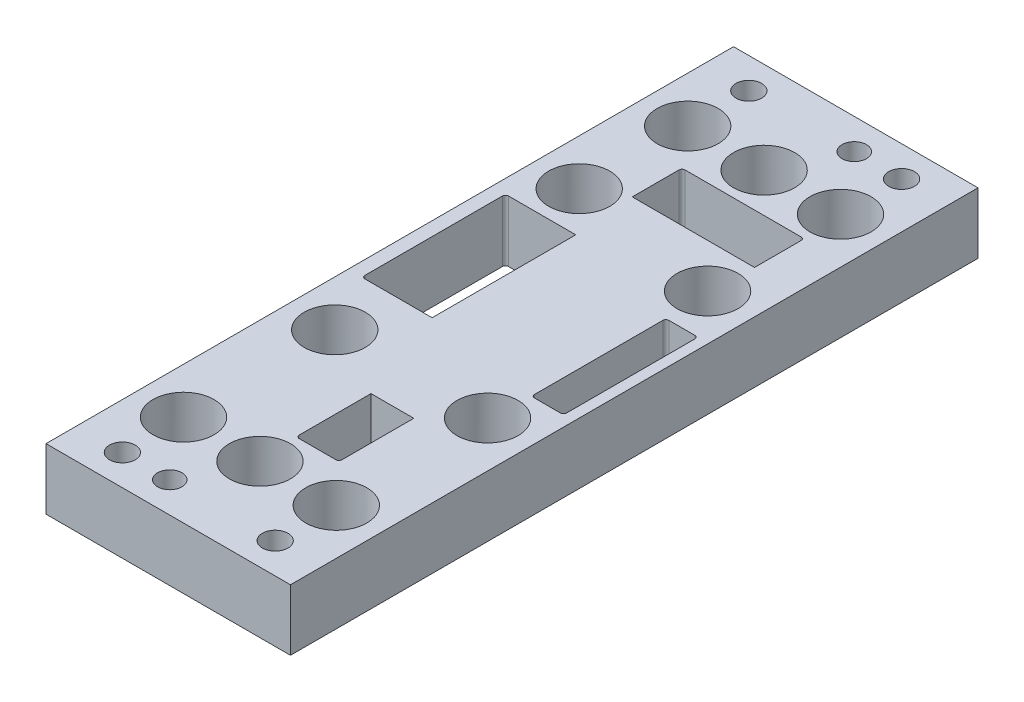
from build123d import *

# Parameters (mm, degrees)
SKETCH1_W                                           = 80
SKETCH1_H                                           = 225
BOSS_EXTRUDE1_DEPTH                                 = 20
CUT_EXTRUDE1_REACH                                  = 125.176
CUT_EXTRUDE2_REACH                                  = 125.176
CUT_EXTRUDE3_REACH                                  = 125.176
CUT_EXTRUDE4_REACH                                  = 125.176
CBORE_FOR_M8_HEX_SOCKET_HEAD_CAP_SCREW1_D           = 8.4
CBORE_FOR_M8_HEX_SOCKET_HEAD_CAP_SCREW1_CBORE_D     = 15
CBORE_FOR_M8_HEX_SOCKET_HEAD_CAP_SCREW1_CBORE_DEPTH = 8.6
F_8_0MM_DOWEL_HOLE1_D                               = 8
CUT_EXTRUDE5_REACH                                  = 125.176
SKETCH7_R                                           = 10


with BuildPart() as part:
    # Sketch1 → Boss-Extrude1 (new body)
    with BuildSketch(Plane(origin=(0, 0, 0), x_dir=(1, 0, 0), z_dir=(0, 1, 0))):
        with Locations((-6, 0)):
            Rectangle(SKETCH1_W, SKETCH1_H)
    extrude(amount=-BOSS_EXTRUDE1_DEPTH)

    # Sketch2 → Cut-Extrude1 (cut, up to next)
    with BuildSketch(Plane(origin=(0, 0, 0), x_dir=(1, 0, 0), z_dir=(0, 1, 0)), mode=Mode.PRIVATE) as cut_extrude1_sk1:
        with BuildLine():
            Line((21, -19.64), (29.5, -19.64))
            ThreePointArc((29.5, -19.64), (30.207106781, -19.347106781), (30.5, -18.64))
            Line((30.5, -18.64), (30.5, 23.36))
            ThreePointArc((30.5, 23.36), (30.207106781, 24.067106781), (29.5, 24.36))
            Line((29.5, 24.36), (21, 24.36))
            ThreePointArc((21, 24.36), (20.292893219, 24.067106781), (20, 23.36))
            Line((20, 23.36), (20, -18.64))
            ThreePointArc((20, -18.64), (20.292893219, -19.347106781), (21, -19.64))
        make_face()
    cut_extrude1_tool1 = extrude(cut_extrude1_sk1.sketch, amount=-CUT_EXTRUDE1_REACH, mode=Mode.PRIVATE) & part.part
    add(cut_extrude1_tool1.solids().sort_by_distance((25.25, 0, -2.36))[0], mode=Mode.SUBTRACT)

    # Sketch4 → Cut-Extrude2 (cut, up to next)
    with BuildSketch(Plane(origin=(0, 0, 0), x_dir=(1, 0, 0), z_dir=(0, 1, 0)), mode=Mode.PRIVATE) as cut_extrude2_sk1:
        with BuildLine():
            Line((7, -68.64), (7, -45.14))
            Line((7, -45.14), (-7, -45.14))
            Line((-7, -45.14), (-7, -68.64))
            ThreePointArc((-7, -68.64), (-6.707106781, -69.347106781), (-6, -69.64))
            Line((-6, -69.64), (6, -69.64))
            ThreePointArc((6, -69.64), (6.707106781, -69.347106781), (7, -68.64))
        make_face()
    cut_extrude2_tool1 = extrude(cut_extrude2_sk1.sketch, amount=-CUT_EXTRUDE2_REACH, mode=Mode.PRIVATE) & part.part
    add(cut_extrude2_tool1.solids().sort_by_distance((0, 0, 57.374932))[0], mode=Mode.SUBTRACT)

    # Sketch5 → Cut-Extrude3 (cut, up to next)
    with BuildSketch(Plane(origin=(0, 0, 0), x_dir=(1, 0, 0), z_dir=(0, 1, 0)), mode=Mode.PRIVATE) as cut_extrude3_sk1:
        with BuildLine():
            Line((-18.5, -13.64), (-18.5, 33.36))
            Line((-18.5, 33.36), (-40.5, 33.36))
            ThreePointArc((-40.5, 33.36), (-41.207106781, 33.067106781), (-41.5, 32.36))
            Line((-41.5, 32.36), (-41.5, -12.64))
            ThreePointArc((-41.5, -12.64), (-41.207106781, -13.347106781), (-40.5, -13.64))
            Line((-40.5, -13.64), (-18.5, -13.64))
        make_face()
    cut_extrude3_tool1 = extrude(cut_extrude3_sk1.sketch, amount=-CUT_EXTRUDE3_REACH, mode=Mode.PRIVATE) & part.part
    add(cut_extrude3_tool1.solids().sort_by_distance((-29.995521, 0, -9.86))[0], mode=Mode.SUBTRACT)

    # Sketch6 → Cut-Extrude4 (cut, up to next)
    with BuildSketch(Plane(origin=(0, 0, 0), x_dir=(1, 0, 0), z_dir=(0, 1, 0)), mode=Mode.PRIVATE) as cut_extrude4_sk1:
        with BuildLine():
            Line((19, 69.64), (-19, 69.64))
            ThreePointArc((-19, 69.64), (-19.707106781, 69.347106781), (-20, 68.64))
            Line((-20, 68.64), (-20, 53.36))
            Line((-20, 53.36), (20, 53.36))
            Line((20, 53.36), (20, 68.64))
            ThreePointArc((20, 68.64), (19.707106781, 69.347106781), (19, 69.64))
        make_face()
    cut_extrude4_tool1 = extrude(cut_extrude4_sk1.sketch, amount=-CUT_EXTRUDE4_REACH, mode=Mode.PRIVATE) & part.part
    add(cut_extrude4_tool1.solids().sort_by_distance((0, 0, -61.494779))[0], mode=Mode.SUBTRACT)

    # CBORE for M8 Hex Socket Head Cap Screw1 (through all)
    with Locations(Plane(origin=(0, -20, 0), x_dir=(-1, 0, 0), z_dir=(0, -1, 0))):
        with Locations((-19, 102.5), (31, 102.5), (-19, -102.5), (31, -102.5)):
            CounterBoreHole(CBORE_FOR_M8_HEX_SOCKET_HEAD_CAP_SCREW1_D / 2, CBORE_FOR_M8_HEX_SOCKET_HEAD_CAP_SCREW1_CBORE_D / 2, CBORE_FOR_M8_HEX_SOCKET_HEAD_CAP_SCREW1_CBORE_DEPTH)

    # Ø8.0mm Dowel Hole1 (through all)
    with Locations(Plane(origin=(0, -20, 0), x_dir=(-1, 0, 0), z_dir=(0, -1, 0))):
        with Locations((-3.5, 102.5), (15.5, -102.5)):
            Hole(F_8_0MM_DOWEL_HOLE1_D / 2)

    # Sketch7 → Cut-Extrude5 (cut, up to next)
    with BuildSketch(Plane(origin=(0, 0, 0), x_dir=(1, 0, 0), z_dir=(0, 1, 0)), mode=Mode.PRIVATE) as cut_extrude5_sk1:
        with Locations((-31, -33)):
            Circle(SKETCH7_R)
    cut_extrude5_tool1 = extrude(cut_extrude5_sk1.sketch, amount=-CUT_EXTRUDE5_REACH, mode=Mode.PRIVATE) & part.part
    # Sketch7 → Cut-Extrude5 (cut, up to next)
    with BuildSketch(Plane(origin=(0, 0, 0), x_dir=(1, 0, 0), z_dir=(0, 1, 0)), mode=Mode.PRIVATE) as cut_extrude5_sk2:
        with Locations((-6, 82.5)):
            Circle(SKETCH7_R)
    cut_extrude5_tool2 = extrude(cut_extrude5_sk2.sketch, amount=-CUT_EXTRUDE5_REACH, mode=Mode.PRIVATE) & part.part
    # Sketch7 → Cut-Extrude5 (cut, up to next)
    with BuildSketch(Plane(origin=(0, 0, 0), x_dir=(1, 0, 0), z_dir=(0, 1, 0)), mode=Mode.PRIVATE) as cut_extrude5_sk3:
        with Locations((19, -33)):
            Circle(SKETCH7_R)
    cut_extrude5_tool3 = extrude(cut_extrude5_sk3.sketch, amount=-CUT_EXTRUDE5_REACH, mode=Mode.PRIVATE) & part.part
    # Sketch7 → Cut-Extrude5 (cut, up to next)
    with BuildSketch(Plane(origin=(0, 0, 0), x_dir=(1, 0, 0), z_dir=(0, 1, 0)), mode=Mode.PRIVATE) as cut_extrude5_sk4:
        with Locations((-31, 47)):
            Circle(SKETCH7_R)
    cut_extrude5_tool4 = extrude(cut_extrude5_sk4.sketch, amount=-CUT_EXTRUDE5_REACH, mode=Mode.PRIVATE) & part.part
    # Sketch7 → Cut-Extrude5 (cut, up to next)
    with BuildSketch(Plane(origin=(0, 0, 0), x_dir=(1, 0, 0), z_dir=(0, 1, 0)), mode=Mode.PRIVATE) as cut_extrude5_sk5:
        with Locations((19, 39)):
            Circle(SKETCH7_R)
    cut_extrude5_tool5 = extrude(cut_extrude5_sk5.sketch, amount=-CUT_EXTRUDE5_REACH, mode=Mode.PRIVATE) & part.part
    # Sketch7 → Cut-Extrude5 (cut, up to next)
    with BuildSketch(Plane(origin=(0, 0, 0), x_dir=(1, 0, 0), z_dir=(0, 1, 0)), mode=Mode.PRIVATE) as cut_extrude5_sk6:
        with Locations((-31, -82.5)):
            Circle(SKETCH7_R)
    cut_extrude5_tool6 = extrude(cut_extrude5_sk6.sketch, amount=-CUT_EXTRUDE5_REACH, mode=Mode.PRIVATE) & part.part
    # Sketch7 → Cut-Extrude5 (cut, up to next)
    with BuildSketch(Plane(origin=(0, 0, 0), x_dir=(1, 0, 0), z_dir=(0, 1, 0)), mode=Mode.PRIVATE) as cut_extrude5_sk7:
        with Locations((-6, -82.5)):
            Circle(SKETCH7_R)
    cut_extrude5_tool7 = extrude(cut_extrude5_sk7.sketch, amount=-CUT_EXTRUDE5_REACH, mode=Mode.PRIVATE) & part.part
    # Sketch7 → Cut-Extrude5 (cut, up to next)
    with BuildSketch(Plane(origin=(0, 0, 0), x_dir=(1, 0, 0), z_dir=(0, 1, 0)), mode=Mode.PRIVATE) as cut_extrude5_sk8:
        with Locations((19, -82.5)):
            Circle(SKETCH7_R)
    cut_extrude5_tool8 = extrude(cut_extrude5_sk8.sketch, amount=-CUT_EXTRUDE5_REACH, mode=Mode.PRIVATE) & part.part
    # Sketch7 → Cut-Extrude5 (cut, up to next)
    with BuildSketch(Plane(origin=(0, 0, 0), x_dir=(1, 0, 0), z_dir=(0, 1, 0)), mode=Mode.PRIVATE) as cut_extrude5_sk9:
        with Locations((-31, 82.5)):
            Circle(SKETCH7_R)
    cut_extrude5_tool9 = extrude(cut_extrude5_sk9.sketch, amount=-CUT_EXTRUDE5_REACH, mode=Mode.PRIVATE) & part.part
    # Sketch7 → Cut-Extrude5 (cut, up to next)
    with BuildSketch(Plane(origin=(0, 0, 0), x_dir=(1, 0, 0), z_dir=(0, 1, 0)), mode=Mode.PRIVATE) as cut_extrude5_sk10:
        with Locations((19, 82.5)):
            Circle(SKETCH7_R)
    cut_extrude5_tool10 = extrude(cut_extrude5_sk10.sketch, amount=-CUT_EXTRUDE5_REACH, mode=Mode.PRIVATE) & part.part
    add(cut_extrude5_tool1.solids().sort_by_distance((-31, 0, 33))[0], mode=Mode.SUBTRACT)
    add(cut_extrude5_tool2.solids().sort_by_distance((-6, 0, -82.5))[0], mode=Mode.SUBTRACT)
    add(cut_extrude5_tool3.solids().sort_by_distance((19, 0, 33))[0], mode=Mode.SUBTRACT)
    add(cut_extrude5_tool4.solids().sort_by_distance((-31, 0, -47))[0], mode=Mode.SUBTRACT)
    add(cut_extrude5_tool5.solids().sort_by_distance((19, 0, -39))[0], mode=Mode.SUBTRACT)
    add(cut_extrude5_tool6.solids().sort_by_distance((-31, 0, 82.5))[0], mode=Mode.SUBTRACT)
    add(cut_extrude5_tool7.solids().sort_by_distance((-6, 0, 82.5))[0], mode=Mode.SUBTRACT)
    add(cut_extrude5_tool8.solids().sort_by_distance((19, 0, 82.5))[0], mode=Mode.SUBTRACT)
    add(cut_extrude5_tool9.solids().sort_by_distance((-31, 0, -82.5))[0], mode=Mode.SUBTRACT)
    add(cut_extrude5_tool10.solids().sort_by_distance((19, 0, -82.5))[0], mode=Mode.SUBTRACT)


solid = part.part
